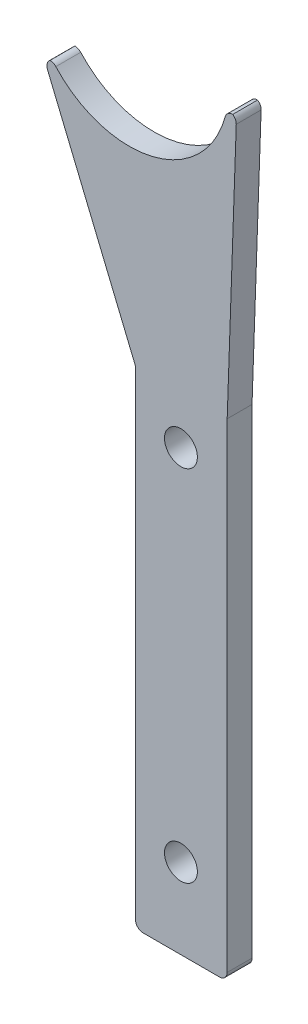
from build123d import *

# Parameters (mm, degrees)
SKETCH1_R           = 2.1
BOSS_EXTRUDE1_DEPTH = 3.175
FILLET2_R           = 1
FILLET3_R           = 1


with BuildPart() as part:
    # Sketch1 → Boss-Extrude1 (new body)
    with BuildSketch(Plane.XY):
        with BuildLine():
            Line((7.553744451, 70.714270531), (-1.524, 70.714270531))
            Line((-1.524, 70.714270531), (-1.524, 132.971298819))
            Line((-1.524, 132.971298819), (-13.246972093, 161.314442451))
            Line((-13.246972093, 161.314442451), (-11.976972093, 161.314442451))
            ThreePointArc((-11.976972093, 161.314442451), (0.849692503, 157.261830841), (10.122503099, 167.006674049))
            Line((10.122503099, 167.006674049), (11.392503099, 167.006674049))
            Line((11.392503099, 167.006674049), (10.2026, 132.971298819))
            Line((10.2026, 132.971298819), (10.2026, 70.714270531))
            Line((10.2026, 70.714270531), (7.553744451, 70.714270531))
        make_face()
        with Locations((4.2926, 126.820276743)):
            Circle(SKETCH1_R, mode=Mode.SUBTRACT)
        with Locations((4.2926, 80.951718801)):
            Circle(SKETCH1_R, mode=Mode.SUBTRACT)
    extrude(amount=BOSS_EXTRUDE1_DEPTH)

    # Fillet2
    fillet2_edges = [part.edges().sort_by_distance(p)[0] for p in [
        (-11.976972093, 161.314442451, 1.5875),
        (10.122503099, 167.006674049, 1.5875),
        (10.2026, 70.714270531, 1.5875),
        (-1.524, 70.714270531, 1.5875),
        (-1.524, 132.971298819, 1.5875),
    ]]
    fillet(fillet2_edges, radius=FILLET2_R)

    # Fillet3
    # the kernel refuses this fillet: 1 mm, written as the material it takes off along each edge
    with BuildSketch(Plane(origin=(-13.246972093, 161.314442451, -3.208100544), x_dir=(1, 0, 0), z_dir=(0, 0, 1))) as fillet3_piece_1:
        with BuildLine():
            CenterArc((1.414539547, -0.803606449), FILLET3_R, 126.524113779, 75.946301344)
            Line((0.490462538, -1.185812782), (0.471980998, -1.193456909))
            Line((0.471980998, -1.193456909), (-0.01848154, -0.007644127))
            Line((-0.01848154, -0.007644127), (0, 0.02))
            ThreePointArc((0, 0.02), (0.409689249, 0.02), (0.807475277, 0.016072129))
            Line((0.807475277, 0.016072129), (0.819378498, 0))
        make_face()
    extrude(amount=9.591201087, mode=Mode.SUBTRACT)
    with BuildSketch(Plane(origin=(11.392503099, 167.006674049, -2.176149378), x_dir=(-1, 0, 0), z_dir=(0, 0, 1))) as fillet3_piece_2:
        with BuildLine():
            CenterArc((1.029802799, 0.834988847), FILLET3_R, 177.997710642, 58.616966228)
            Line((0.030413367, 0.869928276), (0.010425578, 0.870627065))
            Line((0.010425578, 0.870627065), (-0.019987789, 0.000698789))
            Line((-0.019987789, 0.000698789), (0, -0.02))
            ThreePointArc((0, -0.02), (0.239767965, -0.02), (0.468530594, -0.016699777))
            Line((0.468530594, -0.016699777), (0.479535931, 0))
        make_face()
    extrude(amount=7.527298756, mode=Mode.SUBTRACT)


solid = part.part
